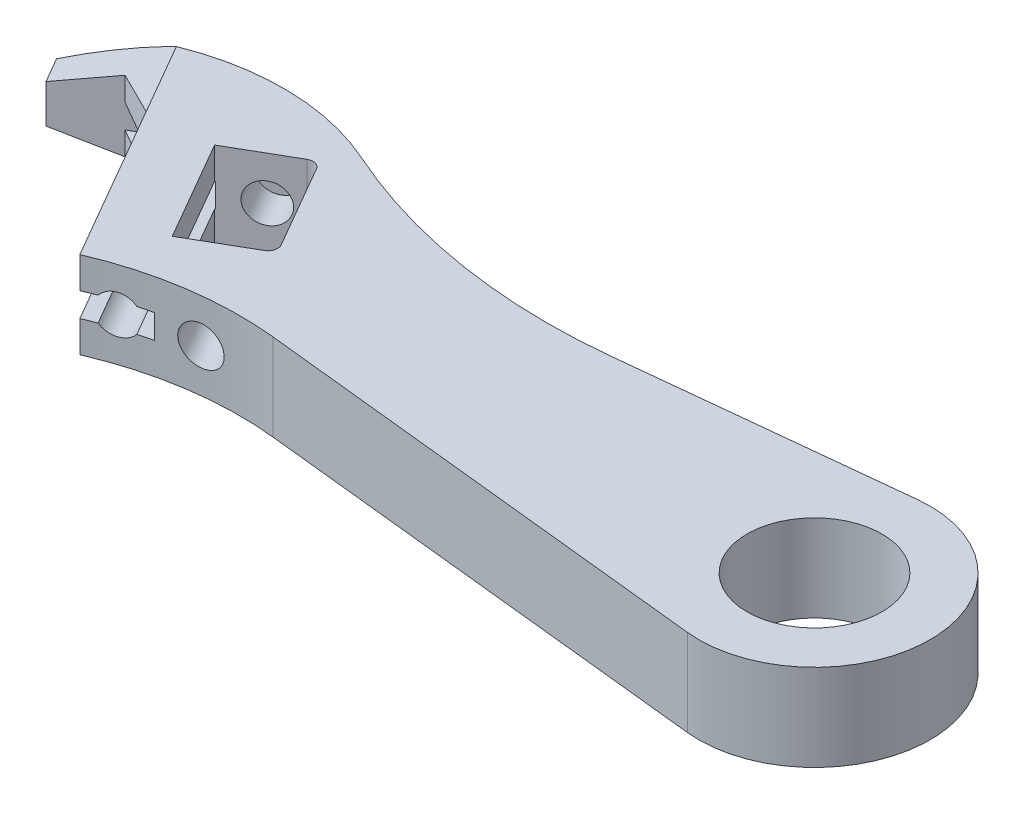
from build123d import *

# Parameters (mm, degrees)
SKETCH1_R           = 7
BOSS_EXTRUDE1_DEPTH = 4.5
SKETCH3_R           = 2
CUT_EXTRUDE1_DEPTH  = 4
SKETCH4_R           = 2
CUT_EXTRUDE2_DEPTH  = 83.455425528
CUT_EXTRUDE3_DEPTH  = 83.769471168
CUT_EXTRUDE4_DEPTH  = 24
FILLET2_R           = 1
CUT_EXTRUDE5_DEPTH  = 1.264527456


# Read off the part's stored shape, not the designer's step: Cut-Extrude5
with BuildPart() as part:
    # Sketch1 → Boss-Extrude1 (new, symmetric)
    # profile 1 of 2: a face of its own
    with BuildSketch(Plane(origin=(0, 0, 0), x_dir=(1, 0, 0), z_dir=(0, 1, 0))):
        with BuildLine():
            ThreePointArc((-1.254341559, -11.934262744), (12, 0), (-1.254341559, 11.934262744))
            Line((-1.254341559, 11.934262744), (-30.046239367, 8.908112343))
            ThreePointArc((-30.046239367, 8.908112343), (-45.765521358, 9.327899994), (-60.835880843, 13.817478255))
            ThreePointArc((-60.835880843, 13.817478255), (-67.496359977, 15.745901742), (-74.430347821, 15.770640847))
            Line((-74.430347821, 15.770640847), (-69.554710794, 7.325789796))
            Line((-69.554710794, 7.325789796), (-62.626507563, 11.325789796))
            Line((-62.626507563, 11.325789796), (-56.626507563, 0.933484951))
            Line((-56.626507563, 0.933484951), (-63.554710794, -3.066515049))
            Line((-63.554710794, -3.066515049), (-60.930347821, -7.612045055))
            ThreePointArc((-60.930347821, -7.612045055), (-55.146607543, -6.760877199), (-49.301873665, -6.884263626))
            Line((-49.301873665, -6.884263626), (-1.254341559, -11.934262744))
        make_face()
        with Locations(Location((0, 0, 0), (0, 0, 270))):
            Circle(SKETCH1_R, mode=Mode.SUBTRACT)
    # profile 2 of 2: a face of its own
    with BuildSketch(Plane(origin=(0, 0, 0), x_dir=(1, 0, 0), z_dir=(0, 1, 0))):
        with BuildLine():
            Line((-69.554710794, 7.325789796), (-74.430347821, 15.770640847))
            ThreePointArc((-74.430347821, 15.770640847), (-81.705916239, 13.616086965), (-88, 9.37810303))
            Line((-88, 9.37810303), (-86.5, 6.780026819))
            Line((-86.5, 6.780026819), (-81.303847577, 9.780026819))
            Line((-81.303847577, 9.780026819), (-76.107695155, 6.780026819))
            Line((-76.107695155, 6.780026819), (-66.705771366, -9.504582872))
            ThreePointArc((-66.705771366, -9.504582872), (-63.859216184, -8.432717138), (-60.930347821, -7.612045055))
            Line((-60.930347821, -7.612045055), (-63.554710794, -3.066515049))
            Line((-63.554710794, -3.066515049), (-69.554710794, 7.325789796))
        make_face()
    extrude(amount=BOSS_EXTRUDE1_DEPTH, both=True)

    # Sketch3 → Cut-Extrude1 (cut)
    with BuildSketch(Plane(origin=(-20.560837732, 0, -35.612415597), x_dir=(0.8660254037844358, 0, -0.5000000000000051), z_dir=(0.500000000000005, 0, 0.8660254037844357))):
        with Locations((-52.573251602, 0)):
            Circle(SKETCH3_R)
    extrude(amount=-CUT_EXTRUDE1_DEPTH, mode=Mode.SUBTRACT)

    # Sketch4 → Cut-Extrude2 (cut, through all)
    with BuildSketch(Plane(origin=(-14.560837732, 0, -25.220110752), x_dir=(-0.8660254037844364, 0, 0.5000000000000041), z_dir=(-0.5000000000000041, 0, -0.8660254037844364))):
        with Locations(Location((52.573251602, 0, 0), (0, 0, 180))):
            Circle(SKETCH4_R)
    extrude(amount=-CUT_EXTRUDE2_DEPTH, mode=Mode.SUBTRACT)

    # Sketch6 → Cut-Extrude3 (cut, through all)
    with BuildSketch(Plane(origin=(-12.560837732, 0, -21.756009137), x_dir=(0.8660254037844358, 0, -0.5000000000000051), z_dir=(0.500000000000005, 0, 0.8660254037844357))):
        Polygon((-71.521184018, -2), (-62.521184018, -4.5), (-71.521184018, -4.5), align=None)
        Polygon((-62.521184018, 4.5), (-71.521184018, 4.5), (-71.521184018, 2), align=None)
    extrude(amount=-CUT_EXTRUDE3_DEPTH, mode=Mode.SUBTRACT)

    # Sketch6<4> → Cut-Extrude4 (cut)
    with BuildSketch(Plane(origin=(-12.560837732, 0, -21.756009137), x_dir=(0.8660254037844358, 0, -0.5000000000000051), z_dir=(0.500000000000005, 0, 0.8660254037844357))):
        with BuildLine():
            Line((-61.082433518, -1.25), (-65.521184018, -1.25))
            Line((-65.521184018, -1.25), (-65.521184018, 1.25))
            Line((-65.521184018, 1.25), (-61.082433518, 1.25))
            ThreePointArc((-61.082433518, 1.25), (-59.521184018, 2), (-57.959934518, 1.25))
            Line((-57.959934518, 1.25), (-56.521184018, 1.25))
            Line((-56.521184018, 1.25), (-56.521184018, -1.25))
            Line((-56.521184018, -1.25), (-57.959934518, -1.25))
            ThreePointArc((-57.959934518, -1.25), (-59.521184018, -2), (-61.082433518, -1.25))
        make_face()
    extrude(amount=-CUT_EXTRUDE4_DEPTH, mode=Mode.SUBTRACT)

    # Fillet2
    fillet2_edges = [part.edges().sort_by_distance(p)[0] for p in [
        (-56.626507563, 0, -0.933484951),
        (-62.626507563, 0, -11.325789796),
    ]]
    fillet(fillet2_edges, radius=FILLET2_R)

    # Cut-Extrude5 outline → Cut-Extrude5 (cut)
    with BuildSketch(Plane(origin=(-12.560837732, 0, -21.756009137), x_dir=(0.8660254037844358, 0, -0.5000000000000051), z_dir=(0.500000000000005, 0, 0.8660254037844357))):
        with BuildLine():
            ThreePointArc((-57.959934518, 1.25), (-59.521184018, 2), (-61.082433518, 1.25))
            Line((-61.082433518, 1.25), (-62.521184018, 1.25))
            Line((-62.521184018, 1.25), (-62.521184018, -1.25))
            Line((-62.521184018, -1.25), (-61.082433518, -1.25))
            ThreePointArc((-61.082433518, -1.25), (-59.521184018, -2), (-57.959934518, -1.25))
            Line((-57.959934518, -1.25), (-56.521184018, -1.25))
            Line((-56.521184018, -1.25), (-56.521184018, 1.25))
            Line((-56.521184018, 1.25), (-57.959934518, 1.25))
        make_face()
    extrude(amount=CUT_EXTRUDE5_DEPTH, mode=Mode.SUBTRACT)


solid = part.part
